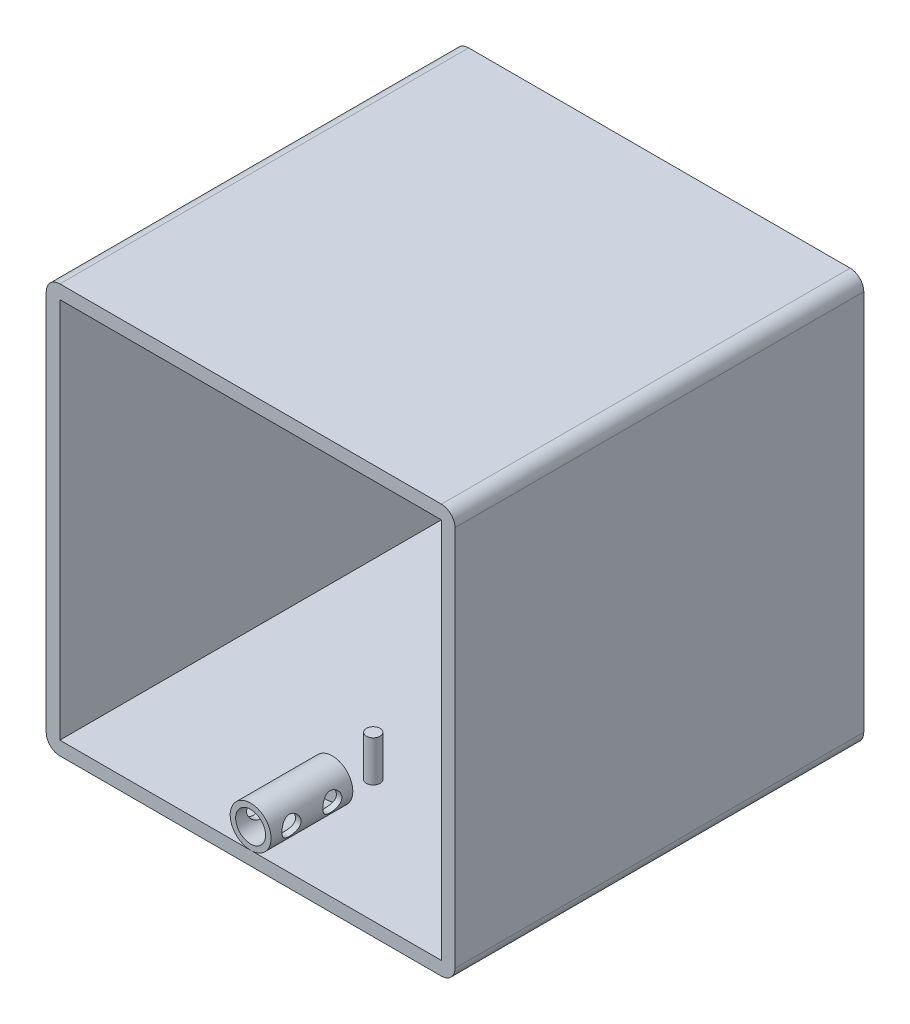
from build123d import *

# Parameters (mm, degrees)
BOSS_EXTRUDE1_DEPTH     = 300
SHELL1_START            = -140
SHELL1_OUTLINE_W        = 280
SHELL1_OUTLINE_H        = 290
SHELL1_DEPTH            = 280
BOSS_EXTRUDE2_START     = 240
SKETCH2_R               = 15
BOSS_EXTRUDE2_DEPTH     = 60
SHELL2_T                = -4
CUT_EXTRUDE1_DEPTH      = 60
CUT_EXTRUDE1_DEPTH_BACK = 60
SKETCH4_R               = 7
SKETCH7_R               = 5
BOSS_EXTRUDE3_DEPTH     = 30


# Read off the part's stored shape, not the designer's step: Shell1
with BuildPart() as part:
    # Sketch1 → Boss-Extrude1 (new body)
    with BuildSketch(Plane.XY):
        with BuildLine():
            Line((-140, -150), (140, -150))
            ThreePointArc((140, -150), (147.071067812, -147.071067812), (150, -140))
            Line((150, -140), (150, 140))
            ThreePointArc((150, 140), (147.071067812, 147.071067812), (140, 150))
            Line((140, 150), (-140, 150))
            ThreePointArc((-140, 150), (-147.071067812, 147.071067812), (-150, 140))
            Line((-150, 140), (-150, -140))
            ThreePointArc((-150, -140), (-147.071067812, -147.071067812), (-140, -150))
        make_face()
    extrude(amount=BOSS_EXTRUDE1_DEPTH)

    # Shell1 outline → Shell1 (cut)
    with BuildSketch(Plane.YZ.offset(SHELL1_START)):
        with Locations((0, 155)):
            Rectangle(SHELL1_OUTLINE_W, SHELL1_OUTLINE_H)
    extrude(amount=SHELL1_DEPTH, mode=Mode.SUBTRACT)

    # Sketch7 → Boss-Extrude3 (add)
    with BuildSketch(Plane(origin=(0, -140, 0), x_dir=(1, 0, 0), z_dir=(0, 1, 0))):
        with Locations(Location((0, -210, 0), (0, 0, 270))):
            Circle(SKETCH7_R)
    extrude(amount=BOSS_EXTRUDE3_DEPTH)


with BuildPart() as body_2:
    # Sketch2 → Boss-Extrude2 (new body)
    with BuildSketch(Plane.XY.offset(BOSS_EXTRUDE2_START)):
        with Locations((0, -125)):
            Circle(SKETCH2_R)
    extrude(amount=BOSS_EXTRUDE2_DEPTH)

    # Shell2
    shell2_openings = [body_2.faces().sort_by_distance(p)[0] for p in [
        (0, -125, 300),
    ]]
    offset(amount=SHELL2_T, openings=shell2_openings, kind=Kind.INTERSECTION)

    # Sketch4 → Cut-Extrude1 (cut, two sides: drawn at the far end of the back side and taken through both)
    with BuildSketch(Plane(origin=(0, 0, 0), x_dir=(0, 0, -1), z_dir=(1, 0, 0)).offset(-CUT_EXTRUDE1_DEPTH_BACK)):
        with Locations(Location((-285, -125, 0), (0, 0, 180))):
            Circle(SKETCH4_R)
        with Locations(Location((-255, -125, 0), (0, 0, 180))):
            Circle(SKETCH4_R)
    extrude(amount=CUT_EXTRUDE1_DEPTH + CUT_EXTRUDE1_DEPTH_BACK, mode=Mode.SUBTRACT)


solid = Compound([part.part, body_2.part])
